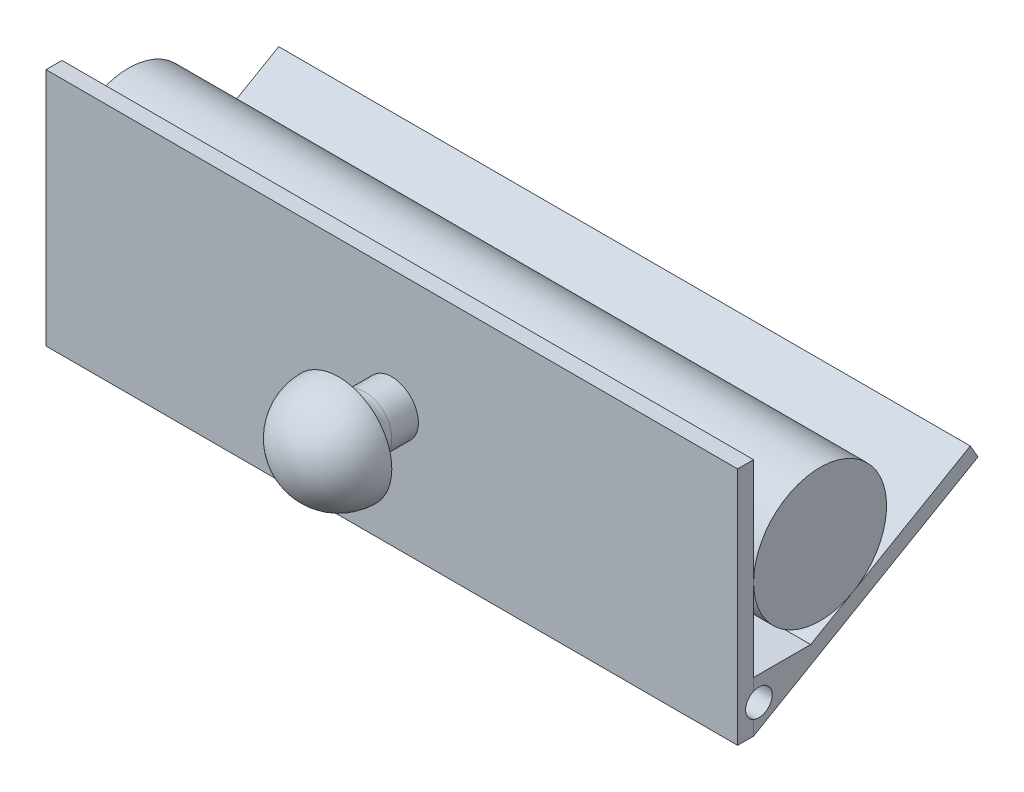
from build123d import *

# Parameters (mm, degrees)
SKETCH1_W             = 130
SKETCH1_H             = 45
BOSS_EXTRUDE1_DEPTH   = 3
SKETCH3_R             = 10
BOSS_EXTRUDE2_DEPTH   = 20
FILLET1_R             = 10
SKETCH4_R             = 10
SKETCH4_R_2           = 5
CUT_EXTRUDE3_DEPTH    = 10
FILLET2_R             = 5
SKETCH5_R             = 12.5
BOSS_EXTRUDE3_DEPTH   = 130
BOSS_EXTRUDE3_2_DEPTH = 130
SKETCH6_R             = 2.5
CUT_EXTRUDE4_DEPTH    = 130


with BuildPart() as part:
    # Sketch1 → Boss-Extrude1 (new body)
    with BuildSketch(Plane.XY):
        with Locations((65, 22.5)):
            Rectangle(SKETCH1_W, SKETCH1_H)
    extrude(amount=BOSS_EXTRUDE1_DEPTH)

    # Sketch3 → Boss-Extrude2 (add)
    with BuildSketch(Plane.XY.offset(3)):
        with Locations(Location((65, 22.5, 0), (0, 0, 180))):
            Circle(SKETCH3_R)
    extrude(amount=BOSS_EXTRUDE2_DEPTH)

    # Fillet1
    fillet1_edges = [part.edges().sort_by_distance(p)[0] for p in [
        (75, 22.5, 23),
    ]]
    fillet(fillet1_edges, radius=FILLET1_R)

    # Sketch4 → Cut-Extrude3 (cut)
    with BuildSketch(Plane.XY.offset(3)):
        with Locations((65, 22.5)):
            Circle(SKETCH4_R)
        with Locations(Location((65, 22.5, 0), (0, 0, 180))):
            Circle(SKETCH4_R_2, mode=Mode.SUBTRACT)
    extrude(amount=CUT_EXTRUDE3_DEPTH, mode=Mode.SUBTRACT)

    # Fillet2
    fillet2_edges = [part.edges().sort_by_distance(p)[0] for p in [
        (70, 22.5, 13),
    ]]
    fillet(fillet2_edges, radius=FILLET2_R - 0.0001)  # a hair under: the kernel refuses the full size


with BuildPart() as body_2:
    # Sketch5 → Boss-Extrude3 (new body)
    with BuildSketch(Plane.ZY):
        with Locations((-12.5, 25)):
            Circle(SKETCH5_R)
    extrude(amount=-BOSS_EXTRUDE3_DEPTH)


with BuildPart() as body_3:
    # Sketch5 → Boss-Extrude3 2 (new body)
    with BuildSketch(Plane.ZY):
        Polygon((-42.187986713, 24.357245486), (0, 0), (0, 9.544756876), (-10.730733666, 9.544756876), (-18.750000123, 14.174682524), (-40.737669166, 26.869269165), align=None)
    extrude(amount=-BOSS_EXTRUDE3_2_DEPTH)


with BuildPart() as cut_extrude4_tool:
    # Sketch6 → Cut-Extrude4 (new body)
    with BuildSketch(Plane.ZY):
        with Locations((-1, 5)):
            Circle(SKETCH6_R)
    extrude(amount=-CUT_EXTRUDE4_DEPTH)


with BuildPart() as part_1:
    add(part.part)

    # Cut-Extrude4: cut by cut_extrude4_tool
    add(cut_extrude4_tool.part, mode=Mode.SUBTRACT)


with BuildPart() as body_3_1:
    add(body_3.part)

    # Cut-Extrude4: cut by cut_extrude4_tool
    add(cut_extrude4_tool.part, mode=Mode.SUBTRACT)


solid = Compound([body_2.part, part_1.part, body_3_1.part])
